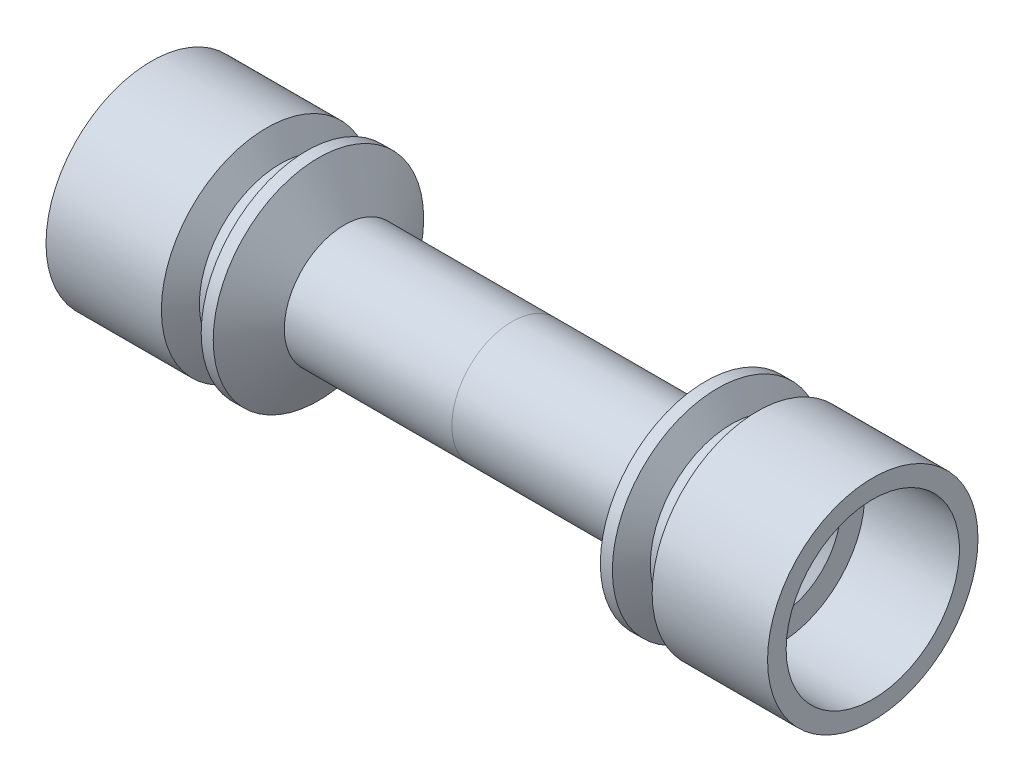
from build123d import *

# Parameters (mm, degrees)
CHAMFER1_SIZE = 0.508


with BuildPart() as part:
    # Sketch2 → Revolve1 (revolve)
    with BuildSketch(Plane.XY):
        Polygon((-12.956984842, 5.55625), (-19.05, 5.55625), (-19.05, 4.575), (-14.05, 4.575), (-14.05, 3.305), (-13.542, 2.797), (-13.542, 1.7145), (-9.225, 1.7145), (-9.225, 1.6), (0, 1.6), (0, 3.175), (-8.84569983, 3.175), (-10.220515158, 5.55625), (-10.855515158, 5.55625), (-11.58875, 4.28625), (-12.22375, 4.28625), align=None)
    revolve(axis=Axis((-19.05, 0, 0), (1, 0, 0)))


with BuildPart() as body_2:
    # Mirror1: mirrored copy
    add(part.part.mirror(Plane(origin=(0, 0, 0), x_dir=(0, 0, 1), z_dir=(1, 0, 0))))


with BuildPart() as part_1:
    add(part.part)

    # Chamfer1
    chamfer1_edges = [part_1.edges().sort_by_distance(p)[0] for p in [
        (-19.05, -4.575, 0),
    ]]
    chamfer(chamfer1_edges, length=CHAMFER1_SIZE)


solid = Compound([body_2.part, part_1.part])
